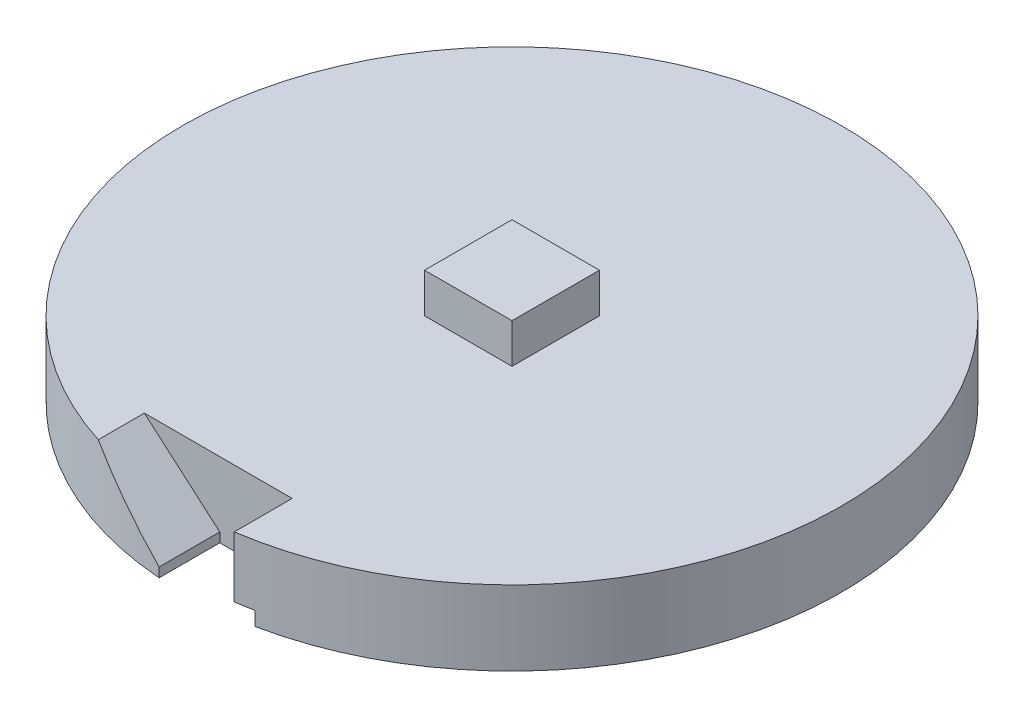
from build123d import *

# Parameters (mm, degrees)
SKETCH1_R           = 37.5
BOSS_EXTRUDE1_DEPTH = 8.5
SKETCH9_W           = 9.95
SKETCH9_H           = 9.95
BOSS_EXTRUDE2_DEPTH = 13
SKETCH2_R           = 5
BOSS_EXTRUDE3_DEPTH = 5
SKETCH11_W          = 5
SKETCH11_H          = 3
CUT_EXTRUDE5_DEPTH  = 10
CUT_EXTRUDE9_DEPTH  = 7


with BuildPart() as part:
    # Sketch1 → Boss-Extrude1 (new body)
    with BuildSketch(Plane(origin=(0, 0, 0), x_dir=(1, 0, 0), z_dir=(0, 1, 0))):
        Circle(SKETCH1_R)
    extrude(amount=BOSS_EXTRUDE1_DEPTH)

    # Sketch9 → Boss-Extrude2 (add)
    with BuildSketch(Plane(origin=(0, 0, 0), x_dir=(1, 0, 0), z_dir=(0, 1, 0))):
        Rectangle(SKETCH9_W, SKETCH9_H)
    extrude(amount=BOSS_EXTRUDE2_DEPTH)

    # Sketch2 → Boss-Extrude3 (add)
    with BuildSketch(Plane.XZ):
        Circle(SKETCH2_R)
    extrude(amount=BOSS_EXTRUDE3_DEPTH)

    # Sketch11 → Cut-Extrude5 (cut)
    with BuildSketch(Plane.XZ.offset(5)):
        with Locations((0.097841348, 0.171762021)):
            Rectangle(SKETCH11_W, SKETCH11_H)
    extrude(amount=-CUT_EXTRUDE5_DEPTH, mode=Mode.SUBTRACT)

    # Sketch14 → Cut-Extrude9 (cut)
    with BuildSketch(Plane.XY.offset(37.5)):
        Polygon((-1.479409771, -0.034279728), (5.487832291, -0.034279728), (7.493094394, 0), (7.493094394, 1.595594951), (5.487832291, 1.595594951), (5.487832291, 5.965720272), (5.487832291, 8.5), (-11.335299807, 8.5), (-2.75755208, 1.072472069), (-2.75755208, 0), align=None)
    extrude(amount=-CUT_EXTRUDE9_DEPTH, mode=Mode.SUBTRACT)


solid = part.part
